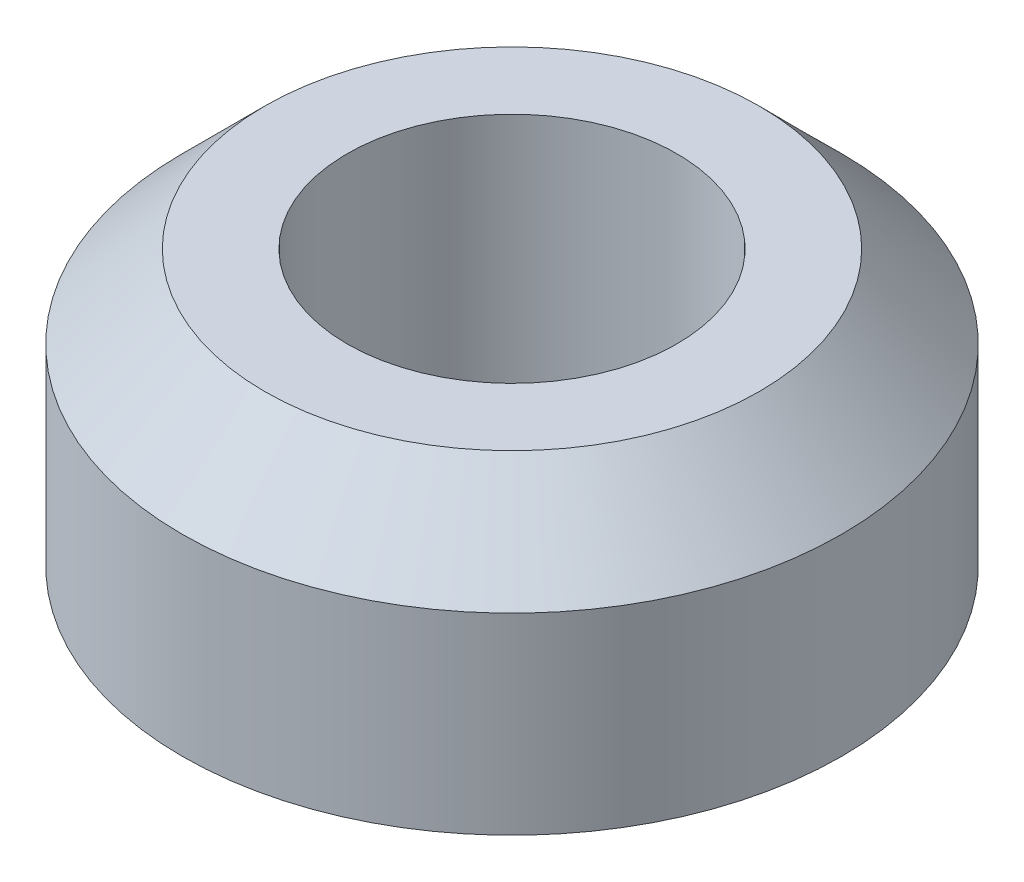
from build123d import *

# Parameters (mm, degrees)
SKETCH1_R           = 6
SKETCH1_R_2         = 3
BOSS_EXTRUDE1_DEPTH = 5
CHAMFER1_SIZE       = 1.5


with BuildPart() as part:
    # Sketch1 → Boss-Extrude1 (new body)
    with BuildSketch(Plane(origin=(0, 0, 0), x_dir=(1, 0, 0), z_dir=(0, 1, 0))):
        Circle(SKETCH1_R)
        Circle(SKETCH1_R_2, mode=Mode.SUBTRACT)
    extrude(amount=BOSS_EXTRUDE1_DEPTH)

    # Chamfer1
    chamfer1_edges = [part.edges().sort_by_distance(p)[0] for p in [
        (-6, 5, 0),
    ]]
    chamfer(chamfer1_edges, length=CHAMFER1_SIZE)


solid = part.part
